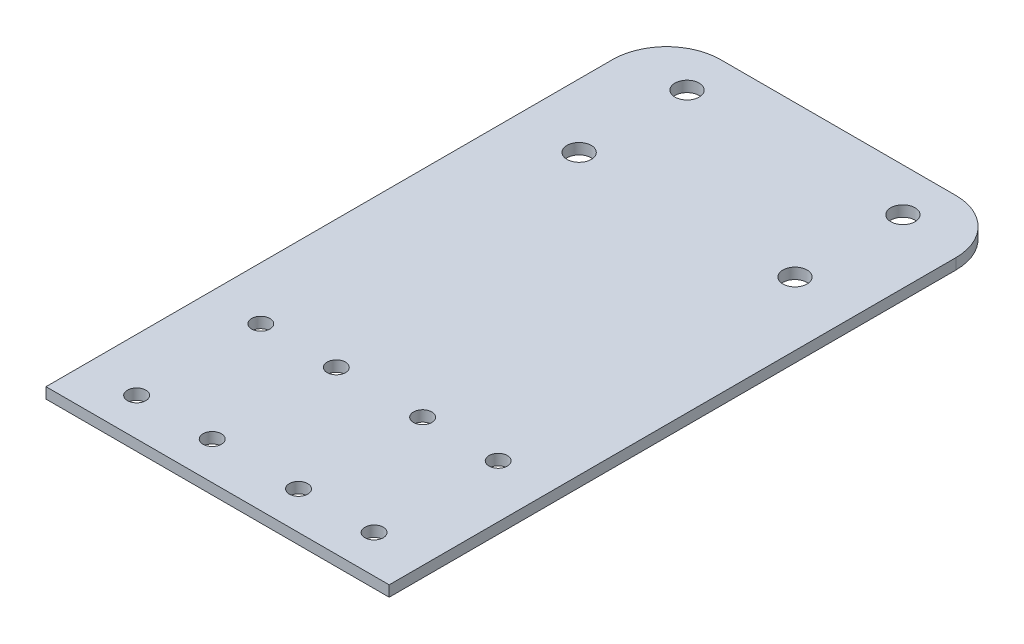
from build123d import *

# Parameters (mm, degrees)
SHEET_EXTRUDE_DEPTH      = 31.8
M3_CLEARANCE_HOLE1_D     = 3.4
M3_CLEARANCE_HOLE1_DEPTH = 8.5
M3_CLEARANCE_HOLE1_TIP   = 1.021463052
M4_CLEARANCE_HOLE1_D     = 4.5
M4_CLEARANCE_HOLE1_DEPTH = 8.5
M4_CLEARANCE_HOLE1_TIP   = 1.351936393
FILLET1_R                = 10


with BuildPart() as part:
    # Sketch2 → Sheet Extrude (new, symmetric)
    with BuildSketch(Plane(origin=(0, 0, 0), x_dir=(0, 0, -1), z_dir=(1, 0, 0))):
        Polygon((0, 0), (0, 2), (-35, 2), (-55, 2), (-115, 2), (-115, 0), (-55, 0), (-35, 0), align=None)
    extrude(amount=SHEET_EXTRUDE_DEPTH, both=True)

    # M3 Clearance Hole1
    with Locations(Plane(origin=(0, 2, 0), x_dir=(1, 0, 0), z_dir=(0, 1, 0))):
        with Locations((-22, -108), (-22, -85), (-8, -85), (-8, -108), (22, -108), (8, -108), (8, -85), (22, -85)):
            Hole(M3_CLEARANCE_HOLE1_D / 2, depth=M3_CLEARANCE_HOLE1_DEPTH)
            with Locations((0, 0, -(M3_CLEARANCE_HOLE1_DEPTH + M3_CLEARANCE_HOLE1_TIP / 2))):  # 118° drill point
                Cone(0, M3_CLEARANCE_HOLE1_D / 2, M3_CLEARANCE_HOLE1_TIP, mode=Mode.SUBTRACT)

    # M4 Clearance Hole1
    with Locations(Plane(origin=(0, 2, 0), x_dir=(1, 0, 0), z_dir=(0, 1, 0))):
        with Locations((-20, -28), (20, -28), (20, -8), (-20, -8)):
            Hole(M4_CLEARANCE_HOLE1_D / 2, depth=M4_CLEARANCE_HOLE1_DEPTH)
            with Locations((0, 0, -(M4_CLEARANCE_HOLE1_DEPTH + M4_CLEARANCE_HOLE1_TIP / 2))):  # 118° drill point
                Cone(0, M4_CLEARANCE_HOLE1_D / 2, M4_CLEARANCE_HOLE1_TIP, mode=Mode.SUBTRACT)

    # Fillet1
    fillet1_edges = [part.edges().sort_by_distance(p)[0] for p in [
        (-31.8, 1, 0),
        (31.8, 1, 0),
    ]]
    fillet(fillet1_edges, radius=FILLET1_R)


solid = part.part
